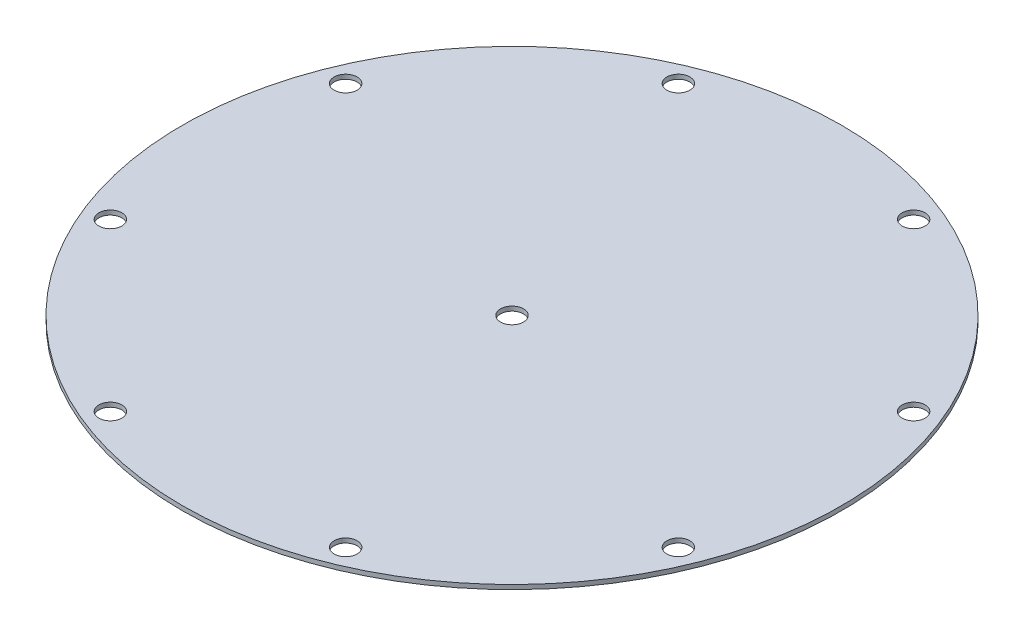
from build123d import *

# Parameters (mm, degrees)
SKETCH2_W                  = 74.375
SKETCH2_H                  = 1
F_6_0_204_DIAMETER_HOLE1_D = 5.1816
CIRPATTERN3_COUNT          = 8
F_6_0_204_DIAMETER_HOLE2_D = 5.1816


with BuildPart() as part:
    # Sketch2 → Revolve1 (revolve)
    with BuildSketch(Plane(origin=(0, 0, 0), x_dir=(0, 0, -1), z_dir=(1, 0, 0))):
        with Locations((-37.1875, 0.5)):
            Rectangle(SKETCH2_W, SKETCH2_H)
    revolve(axis=Axis((0, -0.05, 0), (0, 1, 0)))

    # #6 (0.204) Diameter Hole1 (through all)
    with Locations(Plane(origin=(0, 1, 0), x_dir=(1, 0, 0), z_dir=(0, 1, 0))):
        with Locations((-26.54866312, 64.094142568)):
            f_6_0_204_diameter_hole1 = Hole(F_6_0_204_DIAMETER_HOLE1_D / 2)

    # CirPattern3: #6 (0.204) Diameter Hole1 ×8 about axis
    cirpattern3_axis = Axis((0, -0.05, 0), (0, 1, 0))
    for i in range(1, CIRPATTERN3_COUNT):
        add(f_6_0_204_diameter_hole1.rotate(cirpattern3_axis, i * 360 / CIRPATTERN3_COUNT), mode=Mode.SUBTRACT)

    # #6 (0.204) Diameter Hole2 (through all)
    with Locations(Plane(origin=(0, 1, 0), x_dir=(1, 0, 0), z_dir=(0, 1, 0))):
        with Locations((0, 0)):
            Hole(F_6_0_204_DIAMETER_HOLE2_D / 2)


solid = part.part
